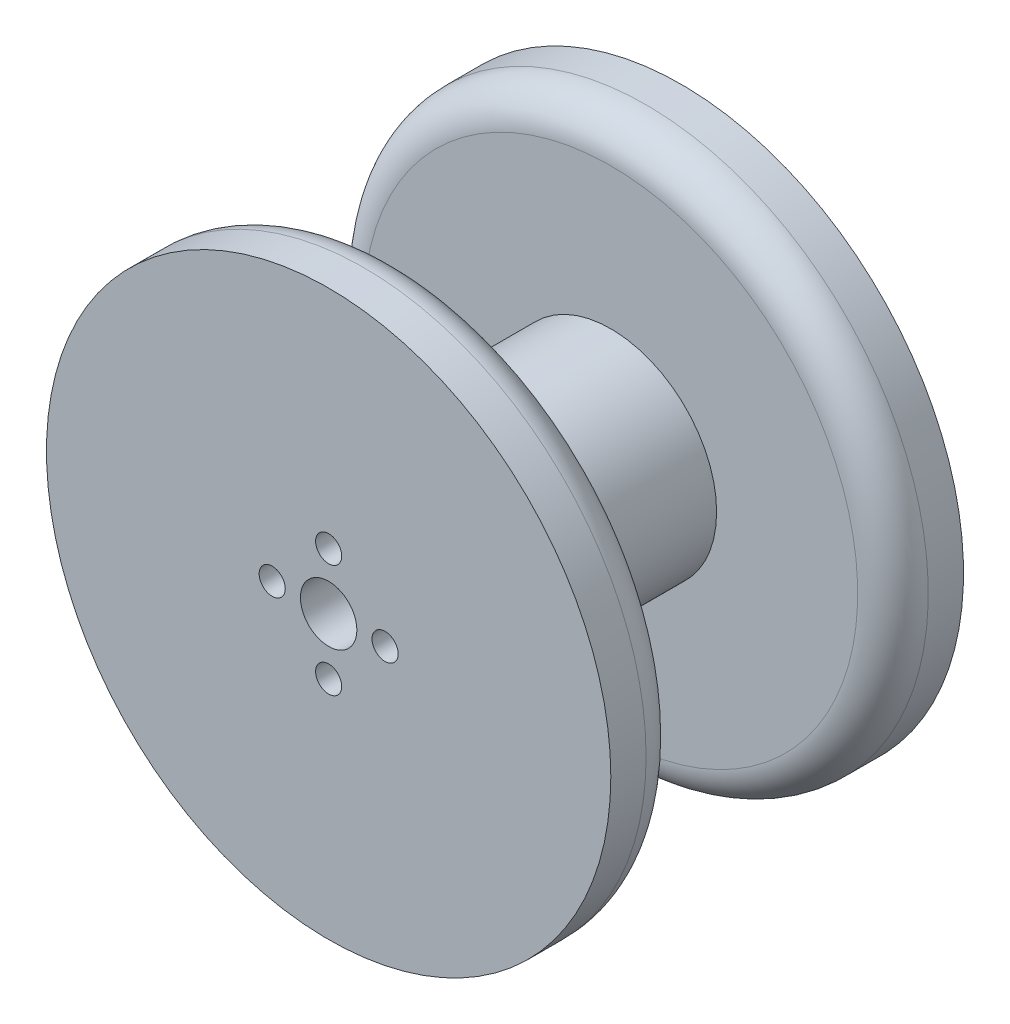
from build123d import *

# Parameters (mm, degrees)
SKETCH1_R           = 40
BOSS_EXTRUDE1_DEPTH = 10
SKETCH2_R           = 15
BOSS_EXTRUDE2_DEPTH = 30
BOSS_EXTRUDE4_START = 10
SKETCH5_R           = 40
BOSS_EXTRUDE4_DEPTH = 10
SKETCH6_R           = 4
SKETCH6_R_2         = 1.85
CUT_EXTRUDE1_DEPTH  = 76.498344353
FILLET1_R           = 5


with BuildPart() as part:
    # Sketch1 → Boss-Extrude1 (new body)
    with BuildSketch(Plane.XY):
        Circle(SKETCH1_R)
    extrude(amount=BOSS_EXTRUDE1_DEPTH)

    # Sketch2 → Boss-Extrude2 (add)
    with BuildSketch(Plane.XY):
        Circle(SKETCH2_R)
    extrude(amount=-BOSS_EXTRUDE2_DEPTH)

    # Sketch5 → Boss-Extrude4 (add)
    with BuildSketch(Plane(origin=(0, 0, -30), x_dir=(-1, 0, 0), z_dir=(0, 0, -1)).offset(BOSS_EXTRUDE4_START)):
        Circle(SKETCH5_R)
    extrude(amount=-BOSS_EXTRUDE4_DEPTH)

    # Sketch6 → Cut-Extrude1 (cut, through all)
    with BuildSketch(Plane.XY.offset(10)):
        Circle(SKETCH6_R)
        with Locations((0, 8)):
            Circle(SKETCH6_R_2)
        with Locations((8, 0)):
            Circle(SKETCH6_R_2)
        with Locations((0, -8)):
            Circle(SKETCH6_R_2)
        with Locations((-8, 0)):
            Circle(SKETCH6_R_2)
    extrude(amount=-CUT_EXTRUDE1_DEPTH, mode=Mode.SUBTRACT)

    # Fillet1
    fillet1_edges = [part.edges().sort_by_distance(p)[0] for p in [
        (-40, 0, 0),
        (40, 0, -30),
    ]]
    fillet(fillet1_edges, radius=FILLET1_R)


solid = part.part
